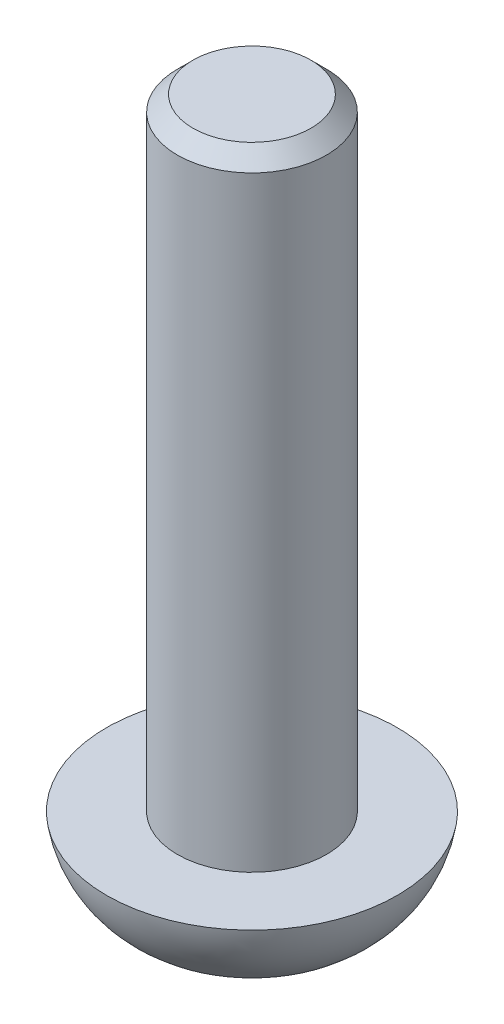
from build123d import *

# Parameters (mm, degrees)
SKETCH1_R           = 4.68
BOSS_EXTRUDE1_DEPTH = 23
SKETCH2_OUTSIDE_W   = 16.668
SKETCH2_OUTSIDE_H   = 16.668
SKETCH2_OUTSIDE_R   = 2.4
CUT_EXTRUDE1_DEPTH  = 20
CHAMFER1_SIZE       = 0.5
CUT_EXTRUDE2_DEPTH  = 2.5
FILLET1_R           = 3.5


with BuildPart() as part:
    # Sketch1 → Boss-Extrude1 (new body)
    with BuildSketch(Plane(origin=(0, 0, 0), x_dir=(1, 0, 0), z_dir=(0, 1, 0))):
        with Locations(Location((0, 0, 0), (0, 0, 270))):
            Circle(SKETCH1_R)
    extrude(amount=BOSS_EXTRUDE1_DEPTH)

    # Sketch2 outside → Cut-Extrude1 (cut)
    with BuildSketch(Plane(origin=(0, 23, 0), x_dir=(1, 0, 0), z_dir=(0, 1, 0))):
        Rectangle(SKETCH2_OUTSIDE_W, SKETCH2_OUTSIDE_H)
        with Locations(Location((0, 0, 0), (0, 0, 270))):
            Circle(SKETCH2_OUTSIDE_R, mode=Mode.SUBTRACT)
    extrude(amount=-CUT_EXTRUDE1_DEPTH, mode=Mode.SUBTRACT)

    # Chamfer1
    chamfer1_edges = [part.edges().sort_by_distance(p)[0] for p in [
        (0, 23, -2.4),
    ]]
    chamfer(chamfer1_edges, length=CHAMFER1_SIZE)

    # Sketch8 → Cut-Extrude2 (cut)
    with BuildSketch(Plane.XZ):
        Polygon((1.870614872, 0), (0.935307436, 1.62), (-0.935307436, 1.62), (-1.870614872, 0), (-0.935307436, -1.62), (0.935307436, -1.62), align=None)
    extrude(amount=-CUT_EXTRUDE2_DEPTH, mode=Mode.SUBTRACT)

    # Fillet1
    # the kernel refuses this fillet: 3.5 mm, written as the material it takes off along each edge
    with BuildSketch(Plane(origin=(0, 0, 0), x_dir=(0, 0, 1), z_dir=(-1, 0, 0))) as fillet1_piece_1:
        with BuildLine():
            CenterArc((1.215898385, 3.5), FILLET1_R, 270, 81.786789298)
            Line((1.215898385, 0), (1.215898385, -0.07))
            Line((1.215898385, -0.07), (4.68, -0.07))
            Line((4.68, -0.07), (4.75, 0))
            ThreePointArc((4.75, 0), (4.75, 1.5), (4.749282032, 2.99))
            Line((4.749282032, 2.99), (4.68, 3))
        make_face()
    revolve(axis=Axis((0, 0, 0), (0, 1, 0)), mode=Mode.SUBTRACT)


solid = part.part
